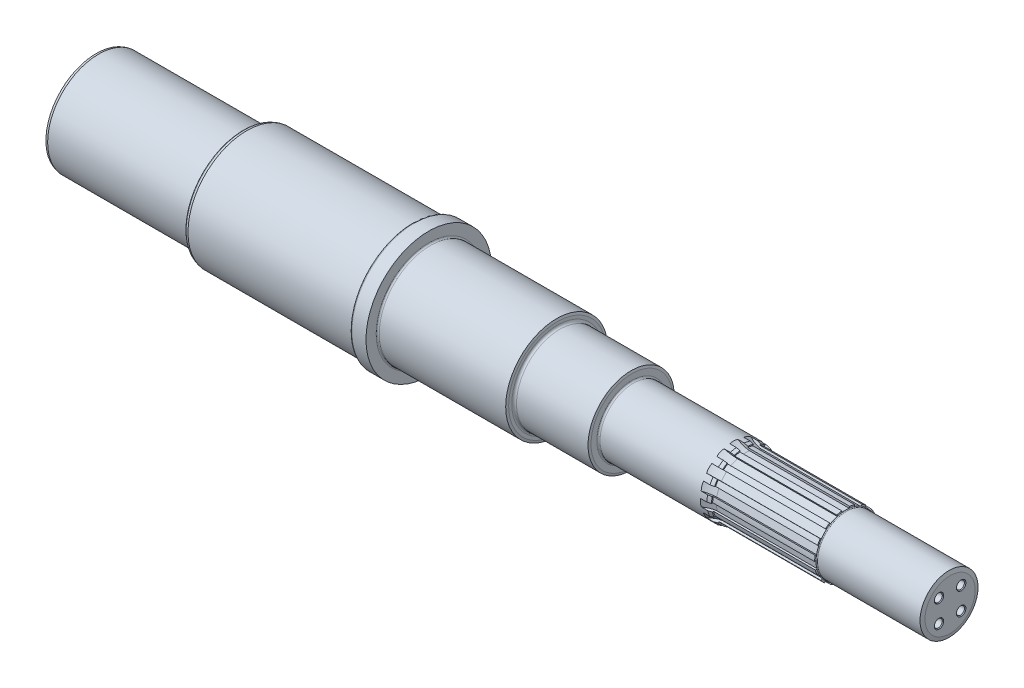
from build123d import *
from OCP.BRepFilletAPI import BRepFilletAPI_MakeChamfer

# Parameters (mm, degrees)
CHANFREIN1_SIZE                   = 3
CHANFREIN1_SIZE2                  = 0.803847577
CHANFREIN2_SIZE                   = 5
CHANFREIN2_SIZE2                  = 1.339745962
TROU_TARAUD_M16X2_01_D            = 14
TROU_TARAUD_M16X2_01_DEPTH        = 37
TROU_TARAUD_M16X2_01_CSINK_D      = 16.05
TROU_TARAUD_M16X2_01_CSINK_ANGLE  = 90
TROU_TARAUD_M16X2_01_TIP          = 4.206024333
TROU_TARAUD_M12X1_751_D           = 10.2
TROU_TARAUD_M12X1_751_DEPTH       = 27.935610843
TROU_TARAUD_M12X1_751_CSINK_D     = 12.05
TROU_TARAUD_M12X1_751_CSINK_ANGLE = 90
TROU_TARAUD_M12X1_751_TIP         = 3.064389157
CHANFREIN5_SIZE                   = 5
CHANFREIN5_SIZE2                  = 1.339745962
CONG_1_R                          = 3
CONG_2_R                          = 2
CONG_6_R                          = 1
ENL_V_MAT_EXTRU_1_DEPTH           = 5
R_P_TITION_START                  = 828
R_P_TITION_CIRCULAIRE1_DEPTH      = 128
R_P_TITION_START_2                = -5
R_P_TITION_CIRCULAIRE1_2_DEPTH    = 10
R_P_TITION_CIRCULAIRE1_3_DEPTH    = 10
R_P_TITION_CIRCULAIRE1_4_DEPTH    = 10
R_P_TITION_CIRCULAIRE1_5_DEPTH    = 10
R_P_TITION_CIRCULAIRE1_6_DEPTH    = 10
R_P_TITION_CIRCULAIRE1_7_DEPTH    = 10
R_P_TITION_CIRCULAIRE1_8_DEPTH    = 10
R_P_TITION_CIRCULAIRE1_9_DEPTH    = 10
R_P_TITION_CIRCULAIRE1_10_DEPTH   = 10
R_P_TITION_CIRCULAIRE1_11_DEPTH   = 10
R_P_TITION_CIRCULAIRE1_12_DEPTH   = 10
R_P_TITION_CIRCULAIRE1_13_DEPTH   = 10
R_P_TITION_CIRCULAIRE1_14_DEPTH   = 10
R_P_TITION_CIRCULAIRE1_15_DEPTH   = 10


with BuildPart() as part:
    # Esquisse1 → Révolution1 (revolve)
    with BuildSketch(Plane.XY, mode=Mode.PRIVATE) as r_volution1_sk:
        Polygon((0, 0), (1089, 0), (1089, 37), (956, 37), (956, 39.8), (826, 39.8), (826, 42.5), (683, 42.5), (683, 55), (588, 55), (588, 65), (424, 65), (424, 80), (404, 80), (404, 75), (187, 75), (187, 65), (0, 65), align=None)
    revolve(r_volution1_sk.sketch.rotate(Axis((0, 0, 0), (1, 0, 0)), 90), axis=Axis((0, 0, 0), (1, 0, 0)))

    # Chanfrein1: one chamfer whose edges measure the first distance from different faces: ONE call of the kernel's chamfer builder (chamfer() names one face for all edges)
    chanfrein1_edges_1 = [part.edges().sort_by_distance(p)[0] for p in [
        (683, 0, -55),
    ]]
    chanfrein1_side_1 = [part.faces().sort_by_distance(p)[0] for p in [
        (683, 0, -44.055634919),
    ]]
    chanfrein1_edges_2 = [part.edges().sort_by_distance(p)[0] for p in [
        (588, 0, -65),
    ]]
    chanfrein1_side_2 = [part.faces().sort_by_distance(p)[0] for p in [
        (588, 0, -56.838477631),
    ]]
    chanfrein1_edges_3 = [part.edges().sort_by_distance(p)[0] for p in [
        (0, 0, -65),
    ]]
    chanfrein1_side_3 = [part.faces().sort_by_distance(p)[0] for p in [
        (93.5, 0, -65),
    ]]
    chanfrein1 = BRepFilletAPI_MakeChamfer(part.part.solid().wrapped)
    for e in chanfrein1_edges_1:
        chanfrein1.Add(CHANFREIN1_SIZE, CHANFREIN1_SIZE2, e.wrapped, chanfrein1_side_1[0].wrapped)  # the first distance lies on this face
    for e in chanfrein1_edges_2:
        chanfrein1.Add(CHANFREIN1_SIZE, CHANFREIN1_SIZE2, e.wrapped, chanfrein1_side_2[0].wrapped)  # the first distance lies on this face
    for e in chanfrein1_edges_3:
        chanfrein1.Add(CHANFREIN1_SIZE, CHANFREIN1_SIZE2, e.wrapped, chanfrein1_side_3[0].wrapped)  # the first distance lies on this face
    add(Compound.cast(chanfrein1.Shape()), mode=Mode.REPLACE)

    # Chanfrein2
    chanfrein2_edges = [part.edges().sort_by_distance(p)[0] for p in [
        (187, 0, -75),
    ]]
    chanfrein2_side = [part.faces().sort_by_distance(p)[0] for p in [
        (295.5, 0, -75),
    ]]
    chamfer(chanfrein2_edges, length=CHANFREIN2_SIZE, length2=CHANFREIN2_SIZE2, reference=chanfrein2_side[0])

    # Trou taraudé M16x2.01
    with Locations(Plane(origin=(0, 35, 0), x_dir=(0, 0, -1), z_dir=(-1, 0, 0))):
        with Locations((0, 0), (35, 35), (0, 70), (-35, 35)):
            CounterSinkHole(TROU_TARAUD_M16X2_01_D / 2, TROU_TARAUD_M16X2_01_CSINK_D / 2, depth=TROU_TARAUD_M16X2_01_DEPTH, counter_sink_angle=TROU_TARAUD_M16X2_01_CSINK_ANGLE)
            with Locations((0, 0, -(TROU_TARAUD_M16X2_01_DEPTH + TROU_TARAUD_M16X2_01_TIP / 2))):  # 118° drill point
                Cone(0, TROU_TARAUD_M16X2_01_D / 2, TROU_TARAUD_M16X2_01_TIP, mode=Mode.SUBTRACT)

    # Trou taraudé M12x1.751
    with Locations(Plane(origin=(1089, 14.142135624, 14.142135624), x_dir=(0, 0, 1), z_dir=(1, 0, 0))):
        with Locations((0, 0), (-28.284271248, 0), (-28.284271248, 28.284271248), (0, 28.284271248)):
            CounterSinkHole(TROU_TARAUD_M12X1_751_D / 2, TROU_TARAUD_M12X1_751_CSINK_D / 2, depth=TROU_TARAUD_M12X1_751_DEPTH, counter_sink_angle=TROU_TARAUD_M12X1_751_CSINK_ANGLE)
            with Locations((0, 0, -(TROU_TARAUD_M12X1_751_DEPTH + TROU_TARAUD_M12X1_751_TIP / 2))):  # 118° drill point
                Cone(0, TROU_TARAUD_M12X1_751_D / 2, TROU_TARAUD_M12X1_751_TIP, mode=Mode.SUBTRACT)

    # Chanfrein5
    chanfrein5_edges = [part.edges().sort_by_distance(p)[0] for p in [
        (1089, 0, -37),
    ]]
    chanfrein5_side = [part.faces().sort_by_distance(p)[0] for p in [
        (1089, 0, 0),
    ]]
    chamfer(chanfrein5_edges, length=CHANFREIN5_SIZE, length2=CHANFREIN5_SIZE2, reference=chanfrein5_side[0])

    # Congé1
    cong_1_edges = [part.edges().sort_by_distance(p)[0] for p in [
        (588, 0, -55),
        (187, 0, -73.660254038),
    ]]
    fillet(cong_1_edges, radius=CONG_1_R)

    # Congé2
    cong_2_edges = [part.edges().sort_by_distance(p)[0] for p in [
        (683, 0, -42.5),
        (424, 0, -65),
        (404, 0, -80),
    ]]
    fillet(cong_2_edges, radius=CONG_2_R)

    # Congé6
    cong_6_edges = [part.edges().sort_by_distance(p)[0] for p in [
        (956, 0, -37),
    ]]
    fillet(cong_6_edges, radius=CONG_6_R)

    # Esquisse6 → Enlèv. mat.-Extru.1 (cut, symmetric)
    with BuildSketch(Plane.XY):
        with BuildLine():
            Line((956, 37), (828, 37))
            ThreePointArc((828, 37), (820.065631955, 38.857787827), (812.775922607, 42.5))
            Line((812.775922607, 42.5), (812.775922607, 65.364600511))
            Line((812.775922607, 65.364600511), (956, 65.364600511))
            Line((956, 65.364600511), (956, 37))
        make_face()
    extrude(amount=ENL_V_MAT_EXTRU_1_DEPTH, both=True, mode=Mode.SUBTRACT)

    # Répétition circulaire1: read off the stored shape, not the designer's step
    # Répétition circulaire1 outline → Répétition circulaire1 (cut)
    with BuildSketch(Plane.YZ.offset(R_P_TITION_START)):
        with BuildLine():
            Line((31.767498717, -19.616983082), (34.037367369, -20.627593718))
            ThreePointArc((34.037367369, -20.627593718), (36.359109214, -16.188118395), (38.1047338, -11.492139141))
            Line((38.1047338, -11.492139141), (35.834865148, -10.481528506))
            Line((35.834865148, -10.481528506), (31.767498717, -19.616983082))
        make_face()
        with BuildLine():
            ThreePointArc((38.1047338, 11.492139141), (36.359109214, 16.188118395), (34.037367369, 20.627593718))
            Line((34.037367369, 20.627593718), (31.767498717, 19.616983082))
            Line((31.767498717, 19.616983082), (35.834865148, 10.481528506))
            Line((35.834865148, 10.481528506), (38.1047338, 11.492139141))
        make_face()
        with BuildLine():
            ThreePointArc((30.136132382, 25.997183022), (26.631398133, 29.577164054), (22.704684127, 32.688489086))
            Line((22.704684127, 32.688489086), (21.042108308, 30.842011574))
            Line((21.042108308, 30.842011574), (28.473556563, 24.150705511))
            Line((28.473556563, 24.150705511), (30.136132382, 25.997183022))
        make_face()
        with BuildLine():
            ThreePointArc((16.956719896, 36.007077782), (12.298876376, 37.852049349), (7.446154733, 39.097247725))
            Line((7.446154733, 39.097247725), (6.67834621, 36.734176075))
            Line((6.67834621, 36.734176075), (16.188911373, 33.644006131))
            Line((16.188911373, 33.644006131), (16.956719896, 36.007077782))
        make_face()
        with BuildLine():
            ThreePointArc((0.845336494, 39.791021679), (-4.160232838, 39.581971436), (-9.09988246, 38.745737046))
            Line((-9.09988246, 38.745737046), (-8.840162618, 36.274667812))
            Line((-8.840162618, 36.274667812), (1.105056336, 37.319952445))
            Line((1.105056336, 37.319952445), (0.845336494, 39.791021679))
        make_face()
        with BuildLine():
            ThreePointArc((-15.412213268, 36.694736437), (-19.9, 34.467811071), (-24.072467306, 31.694736437))
            Line((-24.072467306, 31.694736437), (-22.830127019, 29.54293994))
            Line((-22.830127019, 29.54293994), (-14.169872981, 34.54293994))
            Line((-14.169872981, 34.54293994), (-15.412213268, 36.694736437))
        make_face()
        with BuildLine():
            ThreePointArc((-29.00485134, 27.253597905), (-32.198876376, 23.393853041), (-34.882703863, 19.163427961))
            Line((-34.882703863, 19.163427961), (-32.872555053, 17.702969363))
            Line((-32.872555053, 17.702969363), (-26.99470253, 25.793139307))
            Line((-26.99470253, 25.793139307), (-29.00485134, 27.253597905))
        make_face()
        with BuildLine():
            ThreePointArc((-37.582287115, 13.100064703), (-38.930274509, 8.274885295), (-39.661404023, 3.318588696))
            Line((-39.661404023, 3.318588696), (-37.231019681, 2.801994557))
            Line((-37.231019681, 2.801994557), (-35.151902773, 12.583470564))
            Line((-35.151902773, 12.583470564), (-37.582287115, 13.100064703))
        make_face()
        with BuildLine():
            ThreePointArc((-39.661404023, -3.318588696), (-38.930274509, -8.274885295), (-37.582287115, -13.100064703))
            Line((-37.582287115, -13.100064703), (-35.151902773, -12.583470564))
            Line((-35.151902773, -12.583470564), (-37.231019681, -2.801994557))
            Line((-37.231019681, -2.801994557), (-39.661404023, -3.318588696))
        make_face()
        with BuildLine():
            ThreePointArc((-34.882703863, -19.163427961), (-32.198876376, -23.393853041), (-29.00485134, -27.253597905))
            Line((-29.00485134, -27.253597905), (-26.99470253, -25.793139307))
            Line((-26.99470253, -25.793139307), (-32.872555053, -17.702969363))
            Line((-32.872555053, -17.702969363), (-34.882703863, -19.163427961))
        make_face()
        with BuildLine():
            ThreePointArc((-24.072467306, -31.694736437), (-19.9, -34.467811071), (-15.412213268, -36.694736437))
            Line((-15.412213268, -36.694736437), (-14.169872981, -34.54293994))
            Line((-14.169872981, -34.54293994), (-22.830127019, -29.54293994))
            Line((-22.830127019, -29.54293994), (-24.072467306, -31.694736437))
        make_face()
        with BuildLine():
            ThreePointArc((-9.09988246, -38.745737046), (-4.160232838, -39.581971436), (0.845336494, -39.791021679))
            Line((0.845336494, -39.791021679), (1.105056336, -37.319952445))
            Line((1.105056336, -37.319952445), (-8.840162618, -36.274667812))
            Line((-8.840162618, -36.274667812), (-9.09988246, -38.745737046))
        make_face()
        with BuildLine():
            ThreePointArc((7.446154733, -39.097247725), (12.298876376, -37.852049349), (16.956719896, -36.007077782))
            Line((16.956719896, -36.007077782), (16.188911373, -33.644006131))
            Line((16.188911373, -33.644006131), (6.67834621, -36.734176075))
            Line((6.67834621, -36.734176075), (7.446154733, -39.097247725))
        make_face()
        with BuildLine():
            Line((30.136132382, -25.997183022), (28.473556563, -24.150705511))
            Line((28.473556563, -24.150705511), (21.042108308, -30.842011574))
            Line((21.042108308, -30.842011574), (22.704684127, -32.688489086))
            ThreePointArc((22.704684127, -32.688489086), (26.631398133, -29.577164054), (30.136132382, -25.997183022))
        make_face()
    extrude(amount=R_P_TITION_CIRCULAIRE1_DEPTH, mode=Mode.SUBTRACT)

    # R_p_tition circulaire1 2 outline → R_p_tition circulaire1 2 (cut)
    with BuildSketch(Plane(origin=(0, 0, 0), x_dir=(1, 0, 0), z_dir=(0, 0.7431448254773952, 0.6691306063588572)).offset(R_P_TITION_START_2)):
        with BuildLine():
            Line((828, 37), (828, 44))
            Line((828, 44), (811, 44))
            Line((811, 44), (811, 43.663646679))
            Line((811, 43.663646679), (812.775608996, 42.500205486))
            ThreePointArc((812.775608996, 42.500205486), (820.06545564, 38.857851524), (828, 37))
        make_face()
    extrude(amount=R_P_TITION_CIRCULAIRE1_2_DEPTH, mode=Mode.SUBTRACT)

    # R_p_tition circulaire1 3 outline → R_p_tition circulaire1 3 (cut)
    with BuildSketch(Plane(origin=(0, 0, 0), x_dir=(1, 0, 0), z_dir=(0, 0.994521895368273, -0.104528463267657)).offset(R_P_TITION_START_2)):
        with BuildLine():
            Line((828, 37), (828, 44))
            Line((828, 44), (811, 44))
            Line((811, 44), (811, 43.663646679))
            Line((811, 43.663646679), (812.775608996, 42.500205486))
            ThreePointArc((812.775608996, 42.500205486), (820.06545564, 38.857851524), (828, 37))
        make_face()
    extrude(amount=R_P_TITION_CIRCULAIRE1_3_DEPTH, mode=Mode.SUBTRACT)

    # R_p_tition circulaire1 4 outline → R_p_tition circulaire1 4 (cut)
    with BuildSketch(Plane(origin=(0, 0, 0), x_dir=(1, 0, 0), z_dir=(0, 0.5877852522924693, -0.8090169943749502)).offset(R_P_TITION_START_2)):
        with BuildLine():
            Line((828, 37), (828, 44))
            Line((828, 44), (811, 44))
            Line((811, 44), (811, 43.663646679))
            Line((811, 43.663646679), (812.775608996, 42.500205486))
            ThreePointArc((812.775608996, 42.500205486), (820.06545564, 38.857851524), (828, 37))
        make_face()
    extrude(amount=R_P_TITION_CIRCULAIRE1_4_DEPTH, mode=Mode.SUBTRACT)

    # R_p_tition circulaire1 5 outline → R_p_tition circulaire1 5 (cut)
    with BuildSketch(Plane(origin=(0, 0, 0), x_dir=(1, 0, 0), z_dir=(0, 0.20791169081776606, 0.9781476007338042)).offset(R_P_TITION_START_2)):
        with BuildLine():
            ThreePointArc((828, -37), (820.06545564, -38.857851524), (812.775608996, -42.500205486))
            Line((812.775608996, -42.500205486), (811, -43.663646679))
            Line((811, -43.663646679), (811, -44))
            Line((811, -44), (828, -44))
            Line((828, -44), (828, -37))
        make_face()
    extrude(amount=R_P_TITION_CIRCULAIRE1_5_DEPTH, mode=Mode.SUBTRACT)

    # R_p_tition circulaire1 6 outline → R_p_tition circulaire1 6 (cut)
    with BuildSketch(Plane(origin=(0, 0, 0), x_dir=(1, 0, 0), z_dir=(0, 0.8660254037844433, 0.4999999999999921)).offset(R_P_TITION_START_2)):
        with BuildLine():
            ThreePointArc((828, -37), (820.06545564, -38.857851524), (812.775608996, -42.500205486))
            Line((812.775608996, -42.500205486), (811, -43.663646679))
            Line((811, -43.663646679), (811, -44))
            Line((811, -44), (828, -44))
            Line((828, -44), (828, -37))
        make_face()
    extrude(amount=R_P_TITION_CIRCULAIRE1_6_DEPTH, mode=Mode.SUBTRACT)

    # R_p_tition circulaire1 7 outline → R_p_tition circulaire1 7 (cut)
    with BuildSketch(Plane(origin=(0, 0, 0), x_dir=(1, 0, 0), z_dir=(0, 0.9510565162951505, -0.30901699437495717)).offset(R_P_TITION_START_2)):
        with BuildLine():
            ThreePointArc((828, -37), (820.06545564, -38.857851524), (812.775608996, -42.500205486))
            Line((812.775608996, -42.500205486), (811, -43.663646679))
            Line((811, -43.663646679), (811, -44))
            Line((811, -44), (828, -44))
            Line((828, -44), (828, -37))
        make_face()
    extrude(amount=R_P_TITION_CIRCULAIRE1_7_DEPTH, mode=Mode.SUBTRACT)

    # R_p_tition circulaire1 8 outline → R_p_tition circulaire1 8 (cut)
    with BuildSketch(Plane(origin=(0, 0, 0), x_dir=(1, 0, 0), z_dir=(0, 0.406736643075789, -0.913545457642606)).offset(R_P_TITION_START_2)):
        with BuildLine():
            ThreePointArc((828, -37), (820.06545564, -38.857851524), (812.775608996, -42.500205486))
            Line((812.775608996, -42.500205486), (811, -43.663646679))
            Line((811, -43.663646679), (811, -44))
            Line((811, -44), (828, -44))
            Line((828, -44), (828, -37))
        make_face()
    extrude(amount=R_P_TITION_CIRCULAIRE1_8_DEPTH, mode=Mode.SUBTRACT)

    # R_p_tition circulaire1 9 outline → R_p_tition circulaire1 9 (cut)
    with BuildSketch(Plane(origin=(0, 0, 0), x_dir=(1, 0, 0), z_dir=(0, 0.4067366430758131, 0.9135454576425952)).offset(R_P_TITION_START_2)):
        with BuildLine():
            Line((828, 37), (828, 44))
            Line((828, 44), (811, 44))
            Line((811, 44), (811, 43.663646679))
            Line((811, 43.663646679), (812.775608996, 42.500205486))
            ThreePointArc((812.775608996, 42.500205486), (820.06545564, 38.857851524), (828, 37))
        make_face()
    extrude(amount=R_P_TITION_CIRCULAIRE1_9_DEPTH, mode=Mode.SUBTRACT)

    # R_p_tition circulaire1 10 outline → R_p_tition circulaire1 10 (cut)
    with BuildSketch(Plane(origin=(0, 0, 0), x_dir=(1, 0, 0), z_dir=(0, 0.9510565162951586, 0.30901699437493196)).offset(R_P_TITION_START_2)):
        with BuildLine():
            Line((828, 37), (828, 44))
            Line((828, 44), (811, 44))
            Line((811, 44), (811, 43.663646679))
            Line((811, 43.663646679), (812.775608996, 42.500205486))
            ThreePointArc((812.775608996, 42.500205486), (820.06545564, 38.857851524), (828, 37))
        make_face()
    extrude(amount=R_P_TITION_CIRCULAIRE1_10_DEPTH, mode=Mode.SUBTRACT)

    # R_p_tition circulaire1 11 outline → R_p_tition circulaire1 11 (cut)
    with BuildSketch(Plane(origin=(0, 0, 0), x_dir=(1, 0, 0), z_dir=(0, 0.7431448254773777, -0.6691306063588767)).offset(R_P_TITION_START_2)):
        with BuildLine():
            ThreePointArc((828, -37), (820.06545564, -38.857851524), (812.775608996, -42.500205486))
            Line((812.775608996, -42.500205486), (811, -43.663646679))
            Line((811, -43.663646679), (811, -44))
            Line((811, -44), (828, -44))
            Line((828, -44), (828, -37))
        make_face()
    extrude(amount=R_P_TITION_CIRCULAIRE1_11_DEPTH, mode=Mode.SUBTRACT)

    # R_p_tition circulaire1 12 outline → R_p_tition circulaire1 12 (cut)
    with BuildSketch(Plane(origin=(0, 0, 0), x_dir=(1, 0, 0), z_dir=(0, 0.9945218953682758, 0.10452846326762999)).offset(R_P_TITION_START_2)):
        with BuildLine():
            ThreePointArc((828, -37), (820.065522293, -38.857827445), (812.775727551, -42.500127806))
            Line((812.775727551, -42.500127806), (811, -43.663636402))
            Line((811, -43.663636402), (811, -44))
            Line((811, -44), (828, -44))
            Line((828, -44), (828, -37))
        make_face()
    extrude(amount=R_P_TITION_CIRCULAIRE1_12_DEPTH, mode=Mode.SUBTRACT)

    # R_p_tition circulaire1 13 outline → R_p_tition circulaire1 13 (cut)
    with BuildSketch(Plane(origin=(0, 0, 0), x_dir=(1, 0, 0), z_dir=(0, 0.5877852522924901, 0.8090169943749351)).offset(R_P_TITION_START_2)):
        with BuildLine():
            ThreePointArc((828, -37), (820.06545564, -38.857851524), (812.775608996, -42.500205486))
            Line((812.775608996, -42.500205486), (811, -43.663646679))
            Line((811, -43.663646679), (811, -44))
            Line((811, -44), (828, -44))
            Line((828, -44), (828, -37))
        make_face()
    extrude(amount=R_P_TITION_CIRCULAIRE1_13_DEPTH, mode=Mode.SUBTRACT)

    # R_p_tition circulaire1 14 outline → R_p_tition circulaire1 14 (cut)
    with BuildSketch(Plane(origin=(0, 0, 0), x_dir=(1, 0, 0), z_dir=(0, 0.20791169081773994, -0.9781476007338098)).offset(R_P_TITION_START_2)):
        with BuildLine():
            Line((828, 37), (828, 44))
            Line((828, 44), (811, 44))
            Line((811, 44), (811, 43.663646679))
            Line((811, 43.663646679), (812.775608996, 42.500205486))
            ThreePointArc((812.775608996, 42.500205486), (820.06545564, 38.857851524), (828, 37))
        make_face()
    extrude(amount=R_P_TITION_CIRCULAIRE1_14_DEPTH, mode=Mode.SUBTRACT)

    # R_p_tition circulaire1 15 outline → R_p_tition circulaire1 15 (cut)
    with BuildSketch(Plane(origin=(0, 0, 0), x_dir=(1, 0, 0), z_dir=(0, 0.8660254037844294, -0.5000000000000162)).offset(R_P_TITION_START_2)):
        with BuildLine():
            Line((828, 37), (828, 44))
            Line((828, 44), (811, 44))
            Line((811, 44), (811, 43.663646679))
            Line((811, 43.663646679), (812.775608996, 42.500205486))
            ThreePointArc((812.775608996, 42.500205486), (820.06545564, 38.857851524), (828, 37))
        make_face()
    extrude(amount=R_P_TITION_CIRCULAIRE1_15_DEPTH, mode=Mode.SUBTRACT)

    # Esquisse7 → Enlèvement de matière-Révolution1 (revolve, cut)
    with BuildSketch(Plane.XY, mode=Mode.PRIVATE) as enl_vement_de_mati_re_r_volution1_sk:
        Polygon((818.446208301, 43.294055434), (827.923160435, 40.754713763), (827.923160435, 44.741128797), (818.446208301, 44.741128797), align=None)
    revolve(enl_vement_de_mati_re_r_volution1_sk.sketch.rotate(Axis((0, 0, 0), (-1, 0, 0)), 90), axis=Axis((0, 0, 0), (-1, 0, 0)), mode=Mode.SUBTRACT)


solid = part.part
